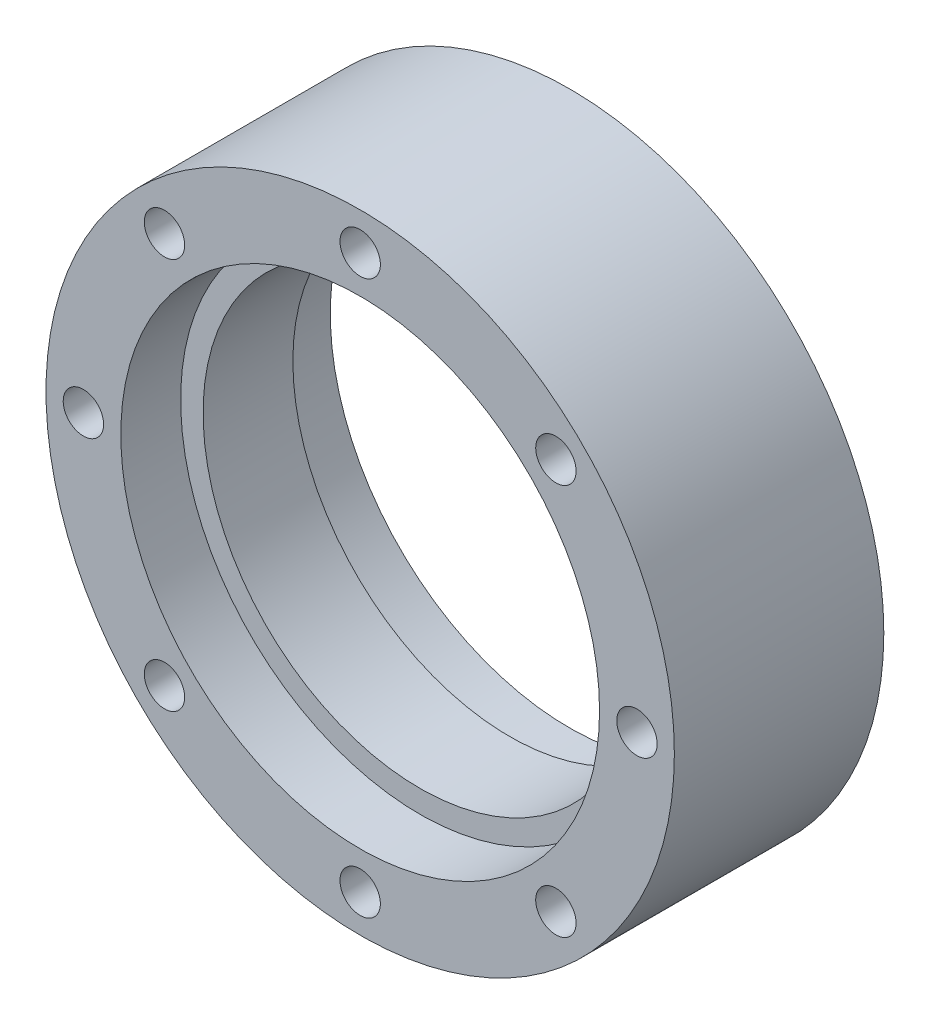
from build123d import *

# Parameters (mm, degrees)
MAINBODY_DEPTH               = 7
MAINBODY_DEPTH_BACK          = 7
SKETCH1_R                    = 21
SKETCH1_R_2                  = 14.5
SKETCH2_R                    = 16
CUT_EXTRUDE1_DEPTH           = 4
SKETCH3_R                    = 1.35
CUT_EXTRUDE2_DEPTH           = 31.512292605
CUT_EXTRUDE4_START           = -2.5
SKETCH4_R                    = 2.25
CUT_EXTRUDE4_DEPTH           = 36.332910319
CHAMFER1_SIZE                = 0.1
CIRPATTERN1_COUNT            = 4
CHAMFER1_OF_CIRPATTERN1_SIZE = 0.1
CIRPATTERN2_COUNT            = 8


with BuildPart() as part:
    # Sketch1 → MainBody (new, two sides: drawn at the far end of the back side and taken through both)
    with BuildSketch(Plane.XY.offset(-MAINBODY_DEPTH_BACK)):
        Circle(SKETCH1_R)
        Circle(SKETCH1_R_2, mode=Mode.SUBTRACT)
    extrude(amount=MAINBODY_DEPTH + MAINBODY_DEPTH_BACK)

    # Sketch2 → Cut-Extrude1 (cut)
    with BuildSketch(Plane.XY.offset(7)):
        Circle(SKETCH2_R)
    cut_extrude1 = extrude(amount=-CUT_EXTRUDE1_DEPTH, mode=Mode.SUBTRACT)

    # Mirror1: Cut-Extrude1 across plane
    add(cut_extrude1.mirror(Plane.XY), mode=Mode.SUBTRACT)

    # Sketch3 → Cut-Extrude2 (cut, symmetric)
    with BuildSketch(Plane.XY):
        with Locations((0, 18.5)):
            Circle(SKETCH3_R)
    cut_extrude2 = extrude(amount=CUT_EXTRUDE2_DEPTH, both=True, mode=Mode.SUBTRACT)

    # Sketch4 → Cut-Extrude4 (cut)
    with BuildSketch(Plane(origin=(0, 0, -7), x_dir=(-1, 0, 0), z_dir=(0, 0, -1)).offset(CUT_EXTRUDE4_START)):
        with Locations((0, 18.5)):
            Circle(SKETCH4_R)
    cut_extrude4 = extrude(amount=CUT_EXTRUDE4_DEPTH, mode=Mode.SUBTRACT)

    # Chamfer1
    chamfer1_edges = [part.edges().sort_by_distance(p)[0] for p in [
        (-1.35, 18.5, -4.5),
    ]]
    chamfer(chamfer1_edges, length=CHAMFER1_SIZE)

    # CirPattern1: Cut-Extrude2, Cut-Extrude4 ×4 about axis
    cirpattern1_axis = Axis((0, 0, 8.25), (0, 0, -1))
    add([cut_extrude2.rotate(cirpattern1_axis, i * 360 / CIRPATTERN1_COUNT) for i in range(1, CIRPATTERN1_COUNT)], mode=Mode.SUBTRACT)
    add([cut_extrude4.rotate(cirpattern1_axis, i * 360 / CIRPATTERN1_COUNT) for i in range(1, CIRPATTERN1_COUNT)], mode=Mode.SUBTRACT)

    # Chamfer1 of CirPattern1
    chamfer1_of_cirpattern1_edges = [part.edges().sort_by_distance(p)[0] for p in [
        (18.5, 1.35, -4.5),
        (1.35, -18.5, -4.5),
        (-18.5, -1.35, -4.5),
    ]]
    chamfer(chamfer1_of_cirpattern1_edges, length=CHAMFER1_OF_CIRPATTERN1_SIZE)

    # CirPattern2: Cut-Extrude2 ×8 about axis
    cirpattern2_axis = Axis((0, 0, 8.25), (0, 0, -1))
    for i in range(1, CIRPATTERN2_COUNT):
        add(cut_extrude2.rotate(cirpattern2_axis, i * 360 / CIRPATTERN2_COUNT), mode=Mode.SUBTRACT)


solid = part.part
